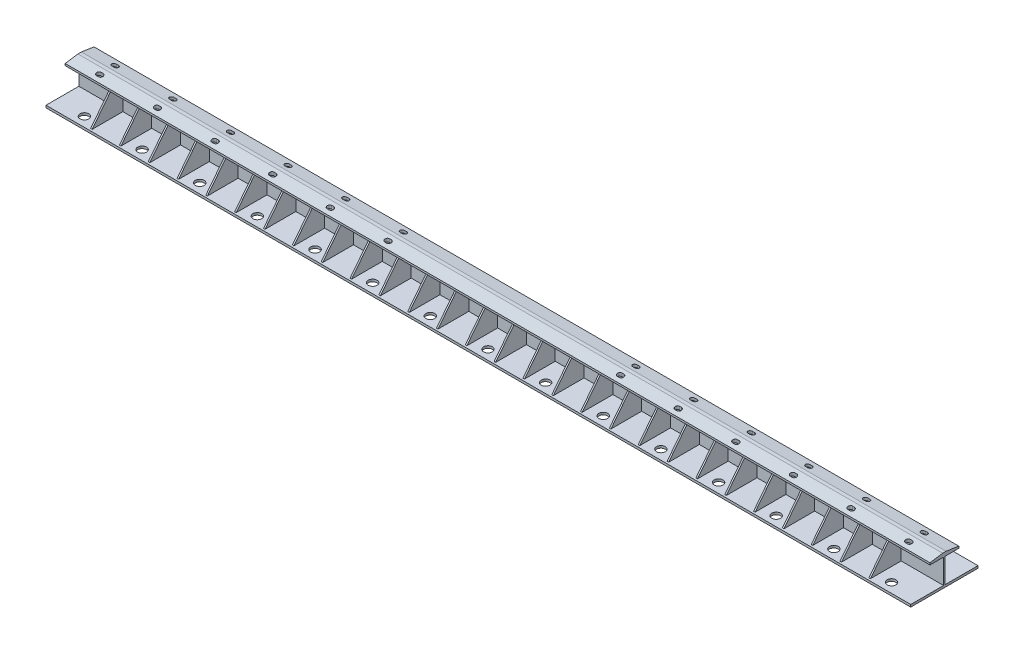
from build123d import *

# Parameters (mm, degrees)
SKETCH_1_W            = 4500
SKETCH_1_H            = 150
EXTRUDE_1_DEPTH       = 20
CUT_EXTRUDE_1_DEPTH   = 2252.338490765
SKETCH_2_W            = 8
SKETCH_2_H            = 128
SKETCH_2_W_2          = 4500
SKETCH_2_H_2          = 8
EXTRUDE_6_DEPTH       = 140
EXTRUDE_7_DEPTH       = 221
EXTRUDE_7_DEPTH_BACK  = 4279
SKETCH_6_W            = 350
SKETCH_6_H            = 12
CUT_EXTRUDE_2_DEPTH   = 4506.577099551
EXTRUDE_8_DEPTH       = 100
EXTRUDE_8_DEPTH_BACK  = 228
SKETCH_13_W           = 8
SKETCH_13_H           = 128
EXTRUDE_9_DEPTH       = 100
EXTRUDE_9_DEPTH_BACK  = 220
SKETCH_17_W           = 8
SKETCH_17_H           = 128
EXTRUDE_36_DEPTH      = 100
EXTRUDE_36_DEPTH_BACK = 228
SKETCH_17_2_W         = 8
SKETCH_17_2_H         = 128
EXTRUDE_10_DEPTH      = 100
EXTRUDE_10_DEPTH_BACK = 228
SKETCH_19_W           = 8
SKETCH_19_H           = 128
EXTRUDE_11_DEPTH      = 100
EXTRUDE_11_DEPTH_BACK = 228
SKETCH_20_W           = 8
SKETCH_20_H           = 128
EXTRUDE_12_DEPTH      = 100
EXTRUDE_12_DEPTH_BACK = 228
SKETCH_21_W           = 8
SKETCH_21_H           = 128
EXTRUDE_13_DEPTH      = 100
EXTRUDE_13_DEPTH_BACK = 228
SKETCH_23_W           = 8
SKETCH_23_H           = 128
EXTRUDE_14_DEPTH      = 100
EXTRUDE_14_DEPTH_BACK = 228
SKETCH_24_W           = 8
SKETCH_24_H           = 128
EXTRUDE_15_DEPTH      = 100
EXTRUDE_15_DEPTH_BACK = 228
SKETCH_25_W           = 8
SKETCH_25_H           = 128
EXTRUDE_16_DEPTH      = 100
EXTRUDE_16_DEPTH_BACK = 228
SKETCH_26_W           = 8
SKETCH_26_H           = 128
EXTRUDE_17_DEPTH      = 100
EXTRUDE_17_DEPTH_BACK = 228
SKETCH_27_W           = 8
SKETCH_27_H           = 128
EXTRUDE_18_DEPTH      = 100
EXTRUDE_18_DEPTH_BACK = 228
SKETCH_28_W           = 8
SKETCH_28_H           = 128
EXTRUDE_19_DEPTH      = 100
EXTRUDE_19_DEPTH_BACK = 228
SKETCH_29_W           = 8
SKETCH_29_H           = 128
EXTRUDE_20_DEPTH      = 100
EXTRUDE_20_DEPTH_BACK = 228
SKETCH_30_W           = 8
SKETCH_30_H           = 128
EXTRUDE_21_DEPTH      = 100
EXTRUDE_21_DEPTH_BACK = 228
SKETCH_31_W           = 8
SKETCH_31_H           = 128
EXTRUDE_22_DEPTH      = 100
EXTRUDE_22_DEPTH_BACK = 228
SKETCH_32_W           = 8
SKETCH_32_H           = 128
EXTRUDE_23_DEPTH      = 100
EXTRUDE_23_DEPTH_BACK = 228
SKETCH_33_W           = 8
SKETCH_33_H           = 128
EXTRUDE_24_DEPTH      = 100
EXTRUDE_24_DEPTH_BACK = 228
SKETCH_34_W           = 8
SKETCH_34_H           = 128
EXTRUDE_25_DEPTH      = 100
EXTRUDE_25_DEPTH_BACK = 228
SKETCH_35_W           = 8
SKETCH_35_H           = 128
EXTRUDE_26_DEPTH      = 100
EXTRUDE_26_DEPTH_BACK = 228
SKETCH_36_W           = 8
SKETCH_36_H           = 128
EXTRUDE_27_DEPTH      = 100
EXTRUDE_27_DEPTH_BACK = 228
SKETCH_37_W           = 8
SKETCH_37_H           = 128
EXTRUDE_28_DEPTH      = 100
EXTRUDE_28_DEPTH_BACK = 228
SKETCH_38_W           = 8
SKETCH_38_H           = 128
EXTRUDE_29_DEPTH      = 100
EXTRUDE_29_DEPTH_BACK = 228
SKETCH_39_W           = 8
SKETCH_39_H           = 128
EXTRUDE_30_DEPTH      = 100
EXTRUDE_30_DEPTH_BACK = 228
SKETCH_40_W           = 8
SKETCH_40_H           = 128
EXTRUDE_31_DEPTH      = 100
EXTRUDE_31_DEPTH_BACK = 228
SKETCH_41_W           = 8
SKETCH_41_H           = 128
EXTRUDE_32_DEPTH      = 100
EXTRUDE_32_DEPTH_BACK = 228
SKETCH_42_W           = 8
SKETCH_42_H           = 128
EXTRUDE_33_DEPTH      = 100
EXTRUDE_33_DEPTH_BACK = 228
SKETCH_43_W           = 8
SKETCH_43_H           = 128
EXTRUDE_34_DEPTH      = 100
EXTRUDE_34_DEPTH_BACK = 228
SKETCH_44_W           = 8
SKETCH_44_H           = 128
EXTRUDE_35_DEPTH      = 100
EXTRUDE_35_DEPTH_BACK = 228
SKETCH_45_W           = 8
SKETCH_45_H           = 128
CUT_EXTRUDE_3_DEPTH   = 4279
SKETCH_47_R           = 23
CUT_EXTRUDE_4_DEPTH   = 12
SKETCH_18_W           = 8
SKETCH_18_H           = 128
EXTRUDE_39_DEPTH      = 10


with BuildPart() as part:
    # 草图1 → 凸台-拉伸1 (new body)
    with BuildSketch(Plane(origin=(0, 0, 0), x_dir=(1, 0, 0), z_dir=(0, 1, 0))):
        Rectangle(SKETCH_1_W, SKETCH_1_H)
    extrude(amount=EXTRUDE_1_DEPTH)

    # 草图3 → 切除-拉伸1 (cut, through all)
    with BuildSketch(Plane.XZ):
        with BuildLine():
            Line((-610, 52), (-600, 52))
            ThreePointArc((-600, 52), (-588, 40), (-600, 28))
            Line((-600, 28), (-610, 28))
            ThreePointArc((-610, 28), (-622, 40), (-610, 52))
        make_face()
        with BuildLine():
            Line((-910, 52), (-900, 52))
            ThreePointArc((-900, 52), (-888, 40), (-900, 28))
            Line((-900, 28), (-910, 28))
            ThreePointArc((-910, 28), (-922, 40), (-910, 52))
        make_face()
        with BuildLine():
            Line((-1210, 52), (-1200, 52))
            ThreePointArc((-1200, 52), (-1188, 40), (-1200, 28))
            Line((-1200, 28), (-1210, 28))
            ThreePointArc((-1210, 28), (-1222, 40), (-1210, 52))
        make_face()
        with BuildLine():
            Line((-1510, 52), (-1500, 52))
            ThreePointArc((-1500, 52), (-1488, 40), (-1500, 28))
            Line((-1500, 28), (-1510, 28))
            ThreePointArc((-1510, 28), (-1522, 40), (-1510, 52))
        make_face()
        with BuildLine():
            Line((-1810, 52), (-1800, 52))
            ThreePointArc((-1800, 52), (-1788, 40), (-1800, 28))
            Line((-1800, 28), (-1810, 28))
            ThreePointArc((-1810, 28), (-1822, 40), (-1810, 52))
        make_face()
        with BuildLine():
            Line((-2110, 52), (-2100, 52))
            ThreePointArc((-2100, 52), (-2088, 40), (-2100, 28))
            Line((-2100, 28), (-2110, 28))
            ThreePointArc((-2110, 28), (-2122, 40), (-2110, 52))
        make_face()
        with BuildLine():
            Line((-2110, -28), (-2100, -28))
            ThreePointArc((-2100, -28), (-2088, -40), (-2100, -52))
            Line((-2100, -52), (-2110, -52))
            ThreePointArc((-2110, -52), (-2122, -40), (-2110, -28))
        make_face()
        with BuildLine():
            Line((-1810, -28), (-1800, -28))
            ThreePointArc((-1800, -28), (-1788, -40), (-1800, -52))
            Line((-1800, -52), (-1810, -52))
            ThreePointArc((-1810, -52), (-1822, -40), (-1810, -28))
        make_face()
        with BuildLine():
            Line((-1510, -28), (-1500, -28))
            ThreePointArc((-1500, -28), (-1488, -40), (-1500, -52))
            Line((-1500, -52), (-1510, -52))
            ThreePointArc((-1510, -52), (-1522, -40), (-1510, -28))
        make_face()
        with BuildLine():
            Line((-1210, -28), (-1200, -28))
            ThreePointArc((-1200, -28), (-1188, -40), (-1200, -52))
            Line((-1200, -52), (-1210, -52))
            ThreePointArc((-1210, -52), (-1222, -40), (-1210, -28))
        make_face()
        with BuildLine():
            Line((-910, -28), (-900, -28))
            ThreePointArc((-900, -28), (-888, -40), (-900, -52))
            Line((-900, -52), (-910, -52))
            ThreePointArc((-910, -52), (-922, -40), (-910, -28))
        make_face()
        with BuildLine():
            Line((600, -28), (610, -28))
            ThreePointArc((610, -28), (622, -40), (610, -52))
            Line((610, -52), (600, -52))
            ThreePointArc((600, -52), (588, -40), (600, -28))
        make_face()
        with BuildLine():
            Line((600, 52), (610, 52))
            ThreePointArc((610, 52), (622, 40), (610, 28))
            Line((610, 28), (600, 28))
            ThreePointArc((600, 28), (588, 40), (600, 52))
        make_face()
        with BuildLine():
            Line((-610, -28), (-600, -28))
            ThreePointArc((-600, -28), (-588, -40), (-600, -52))
            Line((-600, -52), (-610, -52))
            ThreePointArc((-610, -52), (-622, -40), (-610, -28))
        make_face()
        with BuildLine():
            Line((900, 52), (910, 52))
            ThreePointArc((910, 52), (922, 40), (910, 28))
            Line((910, 28), (900, 28))
            ThreePointArc((900, 28), (888, 40), (900, 52))
        make_face()
        with BuildLine():
            Line((900, -28), (910, -28))
            ThreePointArc((910, -28), (922, -40), (910, -52))
            Line((910, -52), (900, -52))
            ThreePointArc((900, -52), (888, -40), (900, -28))
        make_face()
        with BuildLine():
            Line((1200, 52), (1210, 52))
            ThreePointArc((1210, 52), (1222, 40), (1210, 28))
            Line((1210, 28), (1200, 28))
            ThreePointArc((1200, 28), (1188, 40), (1200, 52))
        make_face()
        with BuildLine():
            Line((1200, -28), (1210, -28))
            ThreePointArc((1210, -28), (1222, -40), (1210, -52))
            Line((1210, -52), (1200, -52))
            ThreePointArc((1200, -52), (1188, -40), (1200, -28))
        make_face()
        with BuildLine():
            Line((1500, 52), (1510, 52))
            ThreePointArc((1510, 52), (1522, 40), (1510, 28))
            Line((1510, 28), (1500, 28))
            ThreePointArc((1500, 28), (1488, 40), (1500, 52))
        make_face()
        with BuildLine():
            Line((1500, -28), (1510, -28))
            ThreePointArc((1510, -28), (1522, -40), (1510, -52))
            Line((1510, -52), (1500, -52))
            ThreePointArc((1500, -52), (1488, -40), (1500, -28))
        make_face()
        with BuildLine():
            Line((1800, 52), (1810, 52))
            ThreePointArc((1810, 52), (1822, 40), (1810, 28))
            Line((1810, 28), (1800, 28))
            ThreePointArc((1800, 28), (1788, 40), (1800, 52))
        make_face()
        with BuildLine():
            Line((1800, -28), (1810, -28))
            ThreePointArc((1810, -28), (1822, -40), (1810, -52))
            Line((1810, -52), (1800, -52))
            ThreePointArc((1800, -52), (1788, -40), (1800, -28))
        make_face()
        with BuildLine():
            Line((2100, 52), (2110, 52))
            ThreePointArc((2110, 52), (2122, 40), (2110, 28))
            Line((2110, 28), (2100, 28))
            ThreePointArc((2100, 28), (2088, 40), (2100, 52))
        make_face()
        with BuildLine():
            Line((2100, -28), (2110, -28))
            ThreePointArc((2110, -28), (2122, -40), (2110, -52))
            Line((2110, -52), (2100, -52))
            ThreePointArc((2100, -52), (2088, -40), (2100, -28))
        make_face()
    extrude(amount=-CUT_EXTRUDE_1_DEPTH, mode=Mode.SUBTRACT)

    # 草图2 → 凸台-拉伸6 (add)
    with BuildSketch(Plane.XZ):
        with Locations((225, 0)):
            Rectangle(SKETCH_2_W, SKETCH_2_H)
        Rectangle(SKETCH_2_W_2, SKETCH_2_H_2)
        with Locations((375, 0)):
            Rectangle(SKETCH_2_W, SKETCH_2_H)
        with Locations((525, 0)):
            Rectangle(SKETCH_2_W, SKETCH_2_H)
        with Locations((825, 0)):
            Rectangle(SKETCH_2_W, SKETCH_2_H)
        with Locations((975, 0)):
            Rectangle(SKETCH_2_W, SKETCH_2_H)
        with Locations((1125, 0)):
            Rectangle(SKETCH_2_W, SKETCH_2_H)
        with Locations((1275, 0)):
            Rectangle(SKETCH_2_W, SKETCH_2_H)
        with Locations((1575, 0)):
            Rectangle(SKETCH_2_W, SKETCH_2_H)
        with Locations((1725, 0)):
            Rectangle(SKETCH_2_W, SKETCH_2_H)
        with Locations((1875, 0)):
            Rectangle(SKETCH_2_W, SKETCH_2_H)
        with Locations((1425, 0)):
            Rectangle(SKETCH_2_W, SKETCH_2_H)
        with Locations((675, 0)):
            Rectangle(SKETCH_2_W, SKETCH_2_H)
        with Locations((2025, 0)):
            Rectangle(SKETCH_2_W, SKETCH_2_H)
        with Locations((-675, 0)):
            Rectangle(SKETCH_2_W, SKETCH_2_H)
        with Locations((-1425, 0)):
            Rectangle(SKETCH_2_W, SKETCH_2_H)
        with Locations((-1875, 0)):
            Rectangle(SKETCH_2_W, SKETCH_2_H)
        with Locations((-1725, 0)):
            Rectangle(SKETCH_2_W, SKETCH_2_H)
        with Locations((-1575, 0)):
            Rectangle(SKETCH_2_W, SKETCH_2_H)
        with Locations((-1275, 0)):
            Rectangle(SKETCH_2_W, SKETCH_2_H)
        with Locations((-1125, 0)):
            Rectangle(SKETCH_2_W, SKETCH_2_H)
        with Locations((-975, 0)):
            Rectangle(SKETCH_2_W, SKETCH_2_H)
        with Locations((-825, 0)):
            Rectangle(SKETCH_2_W, SKETCH_2_H)
        with Locations((-525, 0)):
            Rectangle(SKETCH_2_W, SKETCH_2_H)
        with Locations((-375, 0)):
            Rectangle(SKETCH_2_W, SKETCH_2_H)
        with Locations((-225, 0)):
            Rectangle(SKETCH_2_W, SKETCH_2_H)
        with Locations((75, 0)):
            Rectangle(SKETCH_2_W, SKETCH_2_H)
        with Locations((-75, 0)):
            Rectangle(SKETCH_2_W, SKETCH_2_H)
        with Locations((-2025, 0)):
            Rectangle(SKETCH_2_W, SKETCH_2_H)
    extrude(amount=EXTRUDE_6_DEPTH)

    # 草图6 → 凸台-拉伸7 (add, two sides: drawn at the far end of the back side and taken through both)
    with BuildSketch(Plane.ZY.offset(2029).offset(-EXTRUDE_7_DEPTH_BACK)):
        with Locations((0, -134)):
            Rectangle(SKETCH_6_W, SKETCH_6_H)
    extrude(amount=EXTRUDE_7_DEPTH + EXTRUDE_7_DEPTH_BACK)

    # 草图9 → 切除-拉伸2 (cut, through all)
    with BuildSketch(Plane(origin=(2250, 0, 0), x_dir=(0, 0, -1), z_dir=(1, 0, 0))):
        Polygon((-75, 10), (-9, 20), (-75, 20), align=None)
        Polygon((75, 10), (9, 20), (75, 20), align=None)
    extrude(amount=-CUT_EXTRUDE_2_DEPTH, mode=Mode.SUBTRACT)

    # 草图13 → 凸台-拉伸8 (add, two sides: drawn at the far end of the back side and taken through both)
    with BuildSketch(Plane.XY.offset(64).offset(-EXTRUDE_8_DEPTH_BACK)):
        with Locations((2025, -64)):
            Rectangle(SKETCH_13_W, SKETCH_13_H)
    extrude(amount=EXTRUDE_8_DEPTH + EXTRUDE_8_DEPTH_BACK)

    # 草图17 → 凸台-拉伸9 (add, two sides: drawn at the far end of the back side and taken through both)
    with BuildSketch(Plane.XY.offset(64).offset(-EXTRUDE_9_DEPTH_BACK)):
        with Locations((1875, -64)):
            Rectangle(SKETCH_17_W, SKETCH_17_H)
    extrude(amount=EXTRUDE_9_DEPTH + EXTRUDE_9_DEPTH_BACK)

    # 草图17<2> → 凸台-拉伸36 (add, two sides: drawn at the far end of the back side and taken through both)
    with BuildSketch(Plane.XY.offset(64).offset(-EXTRUDE_36_DEPTH_BACK)):
        with Locations((1875, -64)):
            Rectangle(SKETCH_17_2_W, SKETCH_17_2_H)
    extrude(amount=EXTRUDE_36_DEPTH + EXTRUDE_36_DEPTH_BACK)

    # 草图19 → 凸台-拉伸10 (add, two sides: drawn at the far end of the back side and taken through both)
    with BuildSketch(Plane(origin=(0, 0, -64), x_dir=(-1, 0, 0), z_dir=(0, 0, -1)).offset(-EXTRUDE_10_DEPTH_BACK)):
        with Locations((-1725, -64)):
            Rectangle(SKETCH_19_W, SKETCH_19_H)
    extrude(amount=EXTRUDE_10_DEPTH + EXTRUDE_10_DEPTH_BACK)

    # 草图20 → 凸台-拉伸11 (add, two sides: drawn at the far end of the back side and taken through both)
    with BuildSketch(Plane(origin=(0, 0, -64), x_dir=(-1, 0, 0), z_dir=(0, 0, -1)).offset(-EXTRUDE_11_DEPTH_BACK)):
        with Locations((-1575, -64)):
            Rectangle(SKETCH_20_W, SKETCH_20_H)
    extrude(amount=EXTRUDE_11_DEPTH + EXTRUDE_11_DEPTH_BACK)

    # 草图21 → 凸台-拉伸12 (add, two sides: drawn at the far end of the back side and taken through both)
    with BuildSketch(Plane(origin=(0, 0, -64), x_dir=(-1, 0, 0), z_dir=(0, 0, -1)).offset(-EXTRUDE_12_DEPTH_BACK)):
        with Locations((-1425, -64)):
            Rectangle(SKETCH_21_W, SKETCH_21_H)
    extrude(amount=EXTRUDE_12_DEPTH + EXTRUDE_12_DEPTH_BACK)

    # 草图23 → 凸台-拉伸13 (add, two sides: drawn at the far end of the back side and taken through both)
    with BuildSketch(Plane(origin=(0, 0, -64), x_dir=(-1, 0, 0), z_dir=(0, 0, -1)).offset(-EXTRUDE_13_DEPTH_BACK)):
        with Locations((-1275, -64)):
            Rectangle(SKETCH_23_W, SKETCH_23_H)
    extrude(amount=EXTRUDE_13_DEPTH + EXTRUDE_13_DEPTH_BACK)

    # 草图24 → 凸台-拉伸14 (add, two sides: drawn at the far end of the back side and taken through both)
    with BuildSketch(Plane(origin=(0, 0, -64), x_dir=(-1, 0, 0), z_dir=(0, 0, -1)).offset(-EXTRUDE_14_DEPTH_BACK)):
        with Locations((-1125, -64)):
            Rectangle(SKETCH_24_W, SKETCH_24_H)
    extrude(amount=EXTRUDE_14_DEPTH + EXTRUDE_14_DEPTH_BACK)

    # 草图25 → 凸台-拉伸15 (add, two sides: drawn at the far end of the back side and taken through both)
    with BuildSketch(Plane(origin=(0, 0, -64), x_dir=(-1, 0, 0), z_dir=(0, 0, -1)).offset(-EXTRUDE_15_DEPTH_BACK)):
        with Locations((-975, -64)):
            Rectangle(SKETCH_25_W, SKETCH_25_H)
    extrude(amount=EXTRUDE_15_DEPTH + EXTRUDE_15_DEPTH_BACK)

    # 草图26 → 凸台-拉伸16 (add, two sides: drawn at the far end of the back side and taken through both)
    with BuildSketch(Plane(origin=(0, 0, -64), x_dir=(-1, 0, 0), z_dir=(0, 0, -1)).offset(-EXTRUDE_16_DEPTH_BACK)):
        with Locations((-825, -64)):
            Rectangle(SKETCH_26_W, SKETCH_26_H)
    extrude(amount=EXTRUDE_16_DEPTH + EXTRUDE_16_DEPTH_BACK)

    # 草图27 → 凸台-拉伸17 (add, two sides: drawn at the far end of the back side and taken through both)
    with BuildSketch(Plane(origin=(0, 0, -64), x_dir=(-1, 0, 0), z_dir=(0, 0, -1)).offset(-EXTRUDE_17_DEPTH_BACK)):
        with Locations((-675, -64)):
            Rectangle(SKETCH_27_W, SKETCH_27_H)
    extrude(amount=EXTRUDE_17_DEPTH + EXTRUDE_17_DEPTH_BACK)

    # 草图28 → 凸台-拉伸18 (add, two sides: drawn at the far end of the back side and taken through both)
    with BuildSketch(Plane(origin=(0, 0, -64), x_dir=(-1, 0, 0), z_dir=(0, 0, -1)).offset(-EXTRUDE_18_DEPTH_BACK)):
        with Locations((-525, -64)):
            Rectangle(SKETCH_28_W, SKETCH_28_H)
    extrude(amount=EXTRUDE_18_DEPTH + EXTRUDE_18_DEPTH_BACK)

    # 草图29 → 凸台-拉伸19 (add, two sides: drawn at the far end of the back side and taken through both)
    with BuildSketch(Plane(origin=(0, 0, -64), x_dir=(-1, 0, 0), z_dir=(0, 0, -1)).offset(-EXTRUDE_19_DEPTH_BACK)):
        with Locations((-375, -64)):
            Rectangle(SKETCH_29_W, SKETCH_29_H)
    extrude(amount=EXTRUDE_19_DEPTH + EXTRUDE_19_DEPTH_BACK)

    # 草图30 → 凸台-拉伸20 (add, two sides: drawn at the far end of the back side and taken through both)
    with BuildSketch(Plane(origin=(0, 0, -64), x_dir=(-1, 0, 0), z_dir=(0, 0, -1)).offset(-EXTRUDE_20_DEPTH_BACK)):
        with Locations((-225, -64)):
            Rectangle(SKETCH_30_W, SKETCH_30_H)
    extrude(amount=EXTRUDE_20_DEPTH + EXTRUDE_20_DEPTH_BACK)

    # 草图31 → 凸台-拉伸21 (add, two sides: drawn at the far end of the back side and taken through both)
    with BuildSketch(Plane(origin=(0, 0, -64), x_dir=(-1, 0, 0), z_dir=(0, 0, -1)).offset(-EXTRUDE_21_DEPTH_BACK)):
        with Locations((-75, -64)):
            Rectangle(SKETCH_31_W, SKETCH_31_H)
    extrude(amount=EXTRUDE_21_DEPTH + EXTRUDE_21_DEPTH_BACK)

    # 草图32 → 凸台-拉伸22 (add, two sides: drawn at the far end of the back side and taken through both)
    with BuildSketch(Plane(origin=(0, 0, -64), x_dir=(-1, 0, 0), z_dir=(0, 0, -1)).offset(-EXTRUDE_22_DEPTH_BACK)):
        with Locations((75, -64)):
            Rectangle(SKETCH_32_W, SKETCH_32_H)
    extrude(amount=EXTRUDE_22_DEPTH + EXTRUDE_22_DEPTH_BACK)

    # 草图33 → 凸台-拉伸23 (add, two sides: drawn at the far end of the back side and taken through both)
    with BuildSketch(Plane(origin=(0, 0, -64), x_dir=(-1, 0, 0), z_dir=(0, 0, -1)).offset(-EXTRUDE_23_DEPTH_BACK)):
        with Locations((225, -64)):
            Rectangle(SKETCH_33_W, SKETCH_33_H)
    extrude(amount=EXTRUDE_23_DEPTH + EXTRUDE_23_DEPTH_BACK)

    # 草图34 → 凸台-拉伸24 (add, two sides: drawn at the far end of the back side and taken through both)
    with BuildSketch(Plane(origin=(0, 0, -64), x_dir=(-1, 0, 0), z_dir=(0, 0, -1)).offset(-EXTRUDE_24_DEPTH_BACK)):
        with Locations((375, -64)):
            Rectangle(SKETCH_34_W, SKETCH_34_H)
    extrude(amount=EXTRUDE_24_DEPTH + EXTRUDE_24_DEPTH_BACK)

    # 草图35 → 凸台-拉伸25 (add, two sides: drawn at the far end of the back side and taken through both)
    with BuildSketch(Plane(origin=(0, 0, -64), x_dir=(-1, 0, 0), z_dir=(0, 0, -1)).offset(-EXTRUDE_25_DEPTH_BACK)):
        with Locations((525, -64)):
            Rectangle(SKETCH_35_W, SKETCH_35_H)
    extrude(amount=EXTRUDE_25_DEPTH + EXTRUDE_25_DEPTH_BACK)

    # 草图36 → 凸台-拉伸26 (add, two sides: drawn at the far end of the back side and taken through both)
    with BuildSketch(Plane(origin=(0, 0, -64), x_dir=(-1, 0, 0), z_dir=(0, 0, -1)).offset(-EXTRUDE_26_DEPTH_BACK)):
        with Locations((675, -64)):
            Rectangle(SKETCH_36_W, SKETCH_36_H)
    extrude(amount=EXTRUDE_26_DEPTH + EXTRUDE_26_DEPTH_BACK)

    # 草图37 → 凸台-拉伸27 (add, two sides: drawn at the far end of the back side and taken through both)
    with BuildSketch(Plane(origin=(0, 0, -64), x_dir=(-1, 0, 0), z_dir=(0, 0, -1)).offset(-EXTRUDE_27_DEPTH_BACK)):
        with Locations((825, -64)):
            Rectangle(SKETCH_37_W, SKETCH_37_H)
    extrude(amount=EXTRUDE_27_DEPTH + EXTRUDE_27_DEPTH_BACK)

    # 草图38 → 凸台-拉伸28 (add, two sides: drawn at the far end of the back side and taken through both)
    with BuildSketch(Plane(origin=(0, 0, -64), x_dir=(-1, 0, 0), z_dir=(0, 0, -1)).offset(-EXTRUDE_28_DEPTH_BACK)):
        with Locations((975, -64)):
            Rectangle(SKETCH_38_W, SKETCH_38_H)
    extrude(amount=EXTRUDE_28_DEPTH + EXTRUDE_28_DEPTH_BACK)

    # 草图39 → 凸台-拉伸29 (add, two sides: drawn at the far end of the back side and taken through both)
    with BuildSketch(Plane(origin=(0, 0, -64), x_dir=(-1, 0, 0), z_dir=(0, 0, -1)).offset(-EXTRUDE_29_DEPTH_BACK)):
        with Locations((1125, -64)):
            Rectangle(SKETCH_39_W, SKETCH_39_H)
    extrude(amount=EXTRUDE_29_DEPTH + EXTRUDE_29_DEPTH_BACK)

    # 草图40 → 凸台-拉伸30 (add, two sides: drawn at the far end of the back side and taken through both)
    with BuildSketch(Plane(origin=(0, 0, -64), x_dir=(-1, 0, 0), z_dir=(0, 0, -1)).offset(-EXTRUDE_30_DEPTH_BACK)):
        with Locations((1275, -64)):
            Rectangle(SKETCH_40_W, SKETCH_40_H)
    extrude(amount=EXTRUDE_30_DEPTH + EXTRUDE_30_DEPTH_BACK)

    # 草图41 → 凸台-拉伸31 (add, two sides: drawn at the far end of the back side and taken through both)
    with BuildSketch(Plane(origin=(0, 0, -64), x_dir=(-1, 0, 0), z_dir=(0, 0, -1)).offset(-EXTRUDE_31_DEPTH_BACK)):
        with Locations((1425, -64)):
            Rectangle(SKETCH_41_W, SKETCH_41_H)
    extrude(amount=EXTRUDE_31_DEPTH + EXTRUDE_31_DEPTH_BACK)

    # 草图42 → 凸台-拉伸32 (add, two sides: drawn at the far end of the back side and taken through both)
    with BuildSketch(Plane(origin=(0, 0, -64), x_dir=(-1, 0, 0), z_dir=(0, 0, -1)).offset(-EXTRUDE_32_DEPTH_BACK)):
        with Locations((1575, -64)):
            Rectangle(SKETCH_42_W, SKETCH_42_H)
    extrude(amount=EXTRUDE_32_DEPTH + EXTRUDE_32_DEPTH_BACK)

    # 草图43 → 凸台-拉伸33 (add, two sides: drawn at the far end of the back side and taken through both)
    with BuildSketch(Plane(origin=(0, 0, -64), x_dir=(-1, 0, 0), z_dir=(0, 0, -1)).offset(-EXTRUDE_33_DEPTH_BACK)):
        with Locations((1725, -64)):
            Rectangle(SKETCH_43_W, SKETCH_43_H)
    extrude(amount=EXTRUDE_33_DEPTH + EXTRUDE_33_DEPTH_BACK)

    # 草图44 → 凸台-拉伸34 (add, two sides: drawn at the far end of the back side and taken through both)
    with BuildSketch(Plane(origin=(0, 0, -64), x_dir=(-1, 0, 0), z_dir=(0, 0, -1)).offset(-EXTRUDE_34_DEPTH_BACK)):
        with Locations((1875, -64)):
            Rectangle(SKETCH_44_W, SKETCH_44_H)
    extrude(amount=EXTRUDE_34_DEPTH + EXTRUDE_34_DEPTH_BACK)

    # 草图45 → 凸台-拉伸35 (add, two sides: drawn at the far end of the back side and taken through both)
    with BuildSketch(Plane(origin=(0, 0, -64), x_dir=(-1, 0, 0), z_dir=(0, 0, -1)).offset(-EXTRUDE_35_DEPTH_BACK)):
        with Locations((2025, -64)):
            Rectangle(SKETCH_45_W, SKETCH_45_H)
    extrude(amount=EXTRUDE_35_DEPTH + EXTRUDE_35_DEPTH_BACK)

    # 草图46 → 切除-拉伸3 (cut)
    with BuildSketch(Plane(origin=(2029, 0, 0), x_dir=(0, 0, -1), z_dir=(1, 0, 0))):
        Polygon((64, 0), (164, -128), (164, 0), align=None)
        Polygon((-64, 0), (-164, -128), (-164, 0), align=None)
    extrude(amount=-CUT_EXTRUDE_3_DEPTH, mode=Mode.SUBTRACT)

    # 草图47 → 切除-拉伸4 (cut)
    with BuildSketch(Plane.XZ.offset(140)):
        with Locations((0, 125)):
            Circle(SKETCH_47_R)
        with Locations((300, 125)):
            Circle(SKETCH_47_R)
        with Locations((600, 125)):
            Circle(SKETCH_47_R)
        with Locations((900, 125)):
            Circle(SKETCH_47_R)
        with Locations((1200, 125)):
            Circle(SKETCH_47_R)
        with Locations((2100, 125)):
            Circle(SKETCH_47_R)
        with Locations((1800, 125)):
            Circle(SKETCH_47_R)
        with Locations((1500, 125)):
            Circle(SKETCH_47_R)
        with Locations((0, -125)):
            Circle(SKETCH_47_R)
        with Locations((300, -125)):
            Circle(SKETCH_47_R)
        with Locations((600, -125)):
            Circle(SKETCH_47_R)
        with Locations((900, -125)):
            Circle(SKETCH_47_R)
        with Locations((1200, -125)):
            Circle(SKETCH_47_R)
        with Locations((1500, -125)):
            Circle(SKETCH_47_R)
        with Locations((1800, -125)):
            Circle(SKETCH_47_R)
        with Locations((2100, -125)):
            Circle(SKETCH_47_R)
        with Locations((-300, 125)):
            Circle(SKETCH_47_R)
        with Locations((-600, 125)):
            Circle(SKETCH_47_R)
        with Locations((-900, 125)):
            Circle(SKETCH_47_R)
        with Locations((-1200, 125)):
            Circle(SKETCH_47_R)
        with Locations((-1500, 125)):
            Circle(SKETCH_47_R)
        with Locations((-1800, 125)):
            Circle(SKETCH_47_R)
        with Locations((-600, -125)):
            Circle(SKETCH_47_R)
        with Locations((-300, -125)):
            Circle(SKETCH_47_R)
        with Locations((-900, -125)):
            Circle(SKETCH_47_R)
        with Locations((-2100, -125)):
            Circle(SKETCH_47_R)
        with Locations((-1800, -125)):
            Circle(SKETCH_47_R)
        with Locations((-1500, -125)):
            Circle(SKETCH_47_R)
        with Locations((-1200, -125)):
            Circle(SKETCH_47_R)
        with Locations((-2100, 125)):
            Circle(SKETCH_47_R)
    extrude(amount=-CUT_EXTRUDE_4_DEPTH, mode=Mode.SUBTRACT)

    # 草图18 → 凸台-拉伸39 (add)
    with BuildSketch(Plane(origin=(0, 0, -64), x_dir=(-1, 0, 0), z_dir=(0, 0, -1))):
        with Locations((-1725, -64)):
            Rectangle(SKETCH_18_W, SKETCH_18_H)
    extrude(amount=-EXTRUDE_39_DEPTH)


solid = part.part
